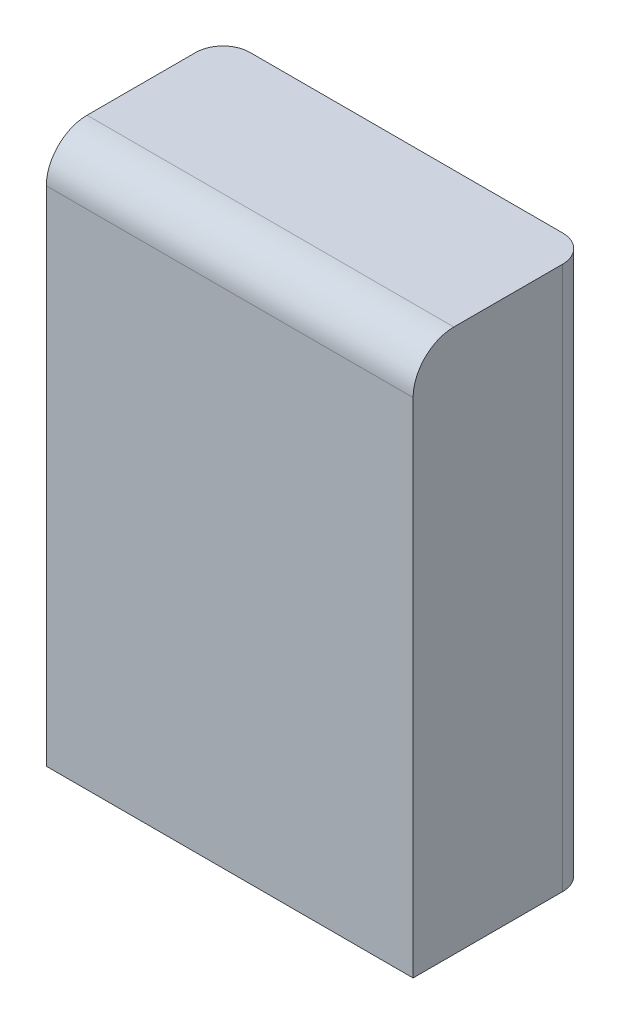
from build123d import *

# Parameters (mm, degrees)
SKETCH1_W                   = 27
SKETCH1_H                   = 13
BOSS_EXTRUDE1_DEPTH         = 40
FILLET1_R                   = 2
FILLET2_R                   = 3
M6_TAPPED_HOLE1_D           = 5
M6_TAPPED_HOLE1_DEPTH       = 17
M6_TAPPED_HOLE1_CSINK_D     = 6.05
M6_TAPPED_HOLE1_CSINK_ANGLE = 90
M6_TAPPED_HOLE1_TIP         = 1.502151548


with BuildPart() as part:
    # Sketch1 → Boss-Extrude1 (new body)
    with BuildSketch(Plane(origin=(0, 0, 0), x_dir=(1, 0, 0), z_dir=(0, 1, 0))):
        Rectangle(SKETCH1_W, SKETCH1_H)
    extrude(amount=-BOSS_EXTRUDE1_DEPTH)

    # Fillet1
    fillet1_edges = [part.edges().sort_by_distance(p)[0] for p in [
        (-13.5, -20, -6.5),
        (13.5, -20, -6.5),
    ]]
    fillet(fillet1_edges, radius=FILLET1_R)

    # Fillet2
    fillet2_edges = [part.edges().sort_by_distance(p)[0] for p in [
        (0, 0, 6.5),
    ]]
    fillet(fillet2_edges, radius=FILLET2_R)

    # M6 Tapped Hole1
    with Locations(Plane(origin=(0, -40, 0), x_dir=(-1, 0, 0), z_dir=(0, -1, 0))):
        with Locations((-6, 0), (6, 0)):
            CounterSinkHole(M6_TAPPED_HOLE1_D / 2, M6_TAPPED_HOLE1_CSINK_D / 2, depth=M6_TAPPED_HOLE1_DEPTH, counter_sink_angle=M6_TAPPED_HOLE1_CSINK_ANGLE)
            with Locations((0, 0, -(M6_TAPPED_HOLE1_DEPTH + M6_TAPPED_HOLE1_TIP / 2))):  # 118° drill point
                Cone(0, M6_TAPPED_HOLE1_D / 2, M6_TAPPED_HOLE1_TIP, mode=Mode.SUBTRACT)


solid = part.part
